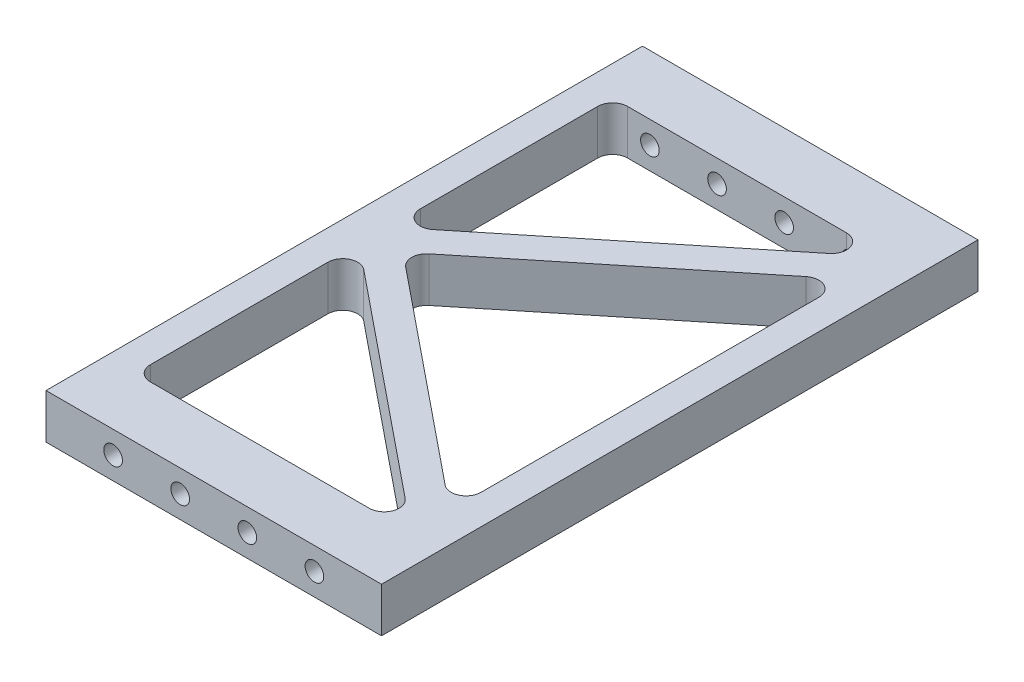
from build123d import *

# Parameters (mm, degrees)
SKETCH_1_W          = 45
SKETCH_1_H          = 80
EXTRUDE_1_DEPTH     = 6
CUT_EXTRUDE_2_DEPTH = 84.320165626
FILLET_10_R         = 2
M3X0_52_D           = 2.5
M3X0_52_DEPTH       = 8.5
M3X0_52_TIP         = 0.751075774
M3X0_51_D           = 2.5
M3X0_51_DEPTH       = 8.5
M3X0_51_TIP         = 0.751075774


with BuildPart() as part:
    # Эскиз1 → Бобышка-Вытянуть1 (new body)
    with BuildSketch(Plane(origin=(0, 0, 0), x_dir=(1, 0, 0), z_dir=(0, 1, 0))):
        with Locations((0, -40)):
            Rectangle(SKETCH_1_W, SKETCH_1_H)
    extrude(amount=EXTRUDE_1_DEPTH)

    # Эскиз13 → Вырез-Вытянуть2 (cut, through all)
    with BuildSketch(Plane(origin=(0, 6, 0), x_dir=(1, 0, 0), z_dir=(0, 1, 0))):
        Polygon((-18.5, -8), (18.5, -8), (-18.5, -38), align=None)
        Polygon((18.5, -72), (-18.5, -42), (-18.5, -72), align=None)
        Polygon((18.5, -13.149623941), (-14.615463806, -40), (18.5, -66.850376059), align=None)
    extrude(amount=-CUT_EXTRUDE_2_DEPTH, mode=Mode.SUBTRACT)

    # Скругление10
    fillet_10_edges = [part.edges().sort_by_distance(p)[0] for p in [
        (-14.615463806, 3, 40),
        (18.5, 3, 13.149623941),
        (18.5, 3, 66.850376059),
        (18.5, 3, 72),
        (-18.5, 3, 72),
        (-18.5, 3, 42),
        (18.5, 3, 8),
        (-18.5, 3, 8),
        (-18.5, 3, 38),
    ]]
    fillet(fillet_10_edges, radius=FILLET_10_R)

    # Отверстие обработанное метчиком M3x0.52
    with Locations(Plane(origin=(0, 0, 0), x_dir=(-1, 0, 0), z_dir=(0, 0, -1))):
        with Locations((-13.5, 3), (-4.5, 3), (4.5, 3), (13.5, 3)):
            Hole(M3X0_52_D / 2, depth=M3X0_52_DEPTH)
            with Locations((0, 0, -(M3X0_52_DEPTH + M3X0_52_TIP / 2))):  # 118° drill point
                Cone(0, M3X0_52_D / 2, M3X0_52_TIP, mode=Mode.SUBTRACT)

    # Отверстие обработанное метчиком M3x0.51
    with Locations(Plane.XY.offset(80)):
        with Locations((-13.5, 3), (-4.5, 3), (4.5, 3), (13.5, 3)):
            Hole(M3X0_51_D / 2, depth=M3X0_51_DEPTH)
            with Locations((0, 0, -(M3X0_51_DEPTH + M3X0_51_TIP / 2))):  # 118° drill point
                Cone(0, M3X0_51_D / 2, M3X0_51_TIP, mode=Mode.SUBTRACT)


solid = part.part
